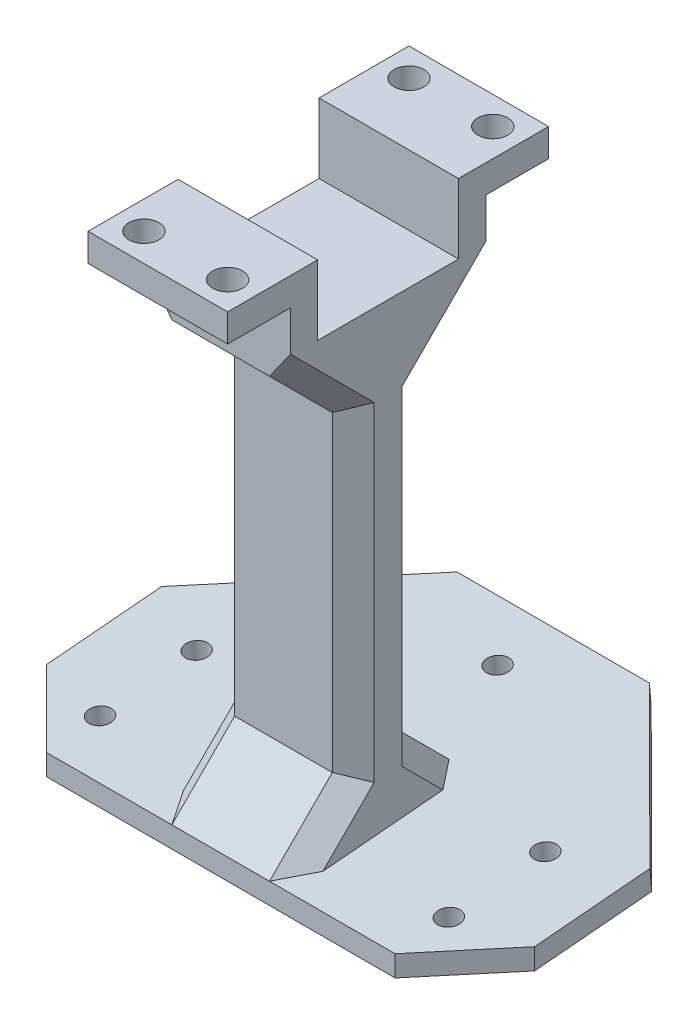
from build123d import *

# Parameters (mm, degrees)
SKETCH1_W           = 20
SKETCH1_H           = 53.344530479
BOSS_EXTRUDE1_DEPTH = 28
BOSS_EXTRUDE2_START = -426.399445517
BOSS_EXTRUDE2_DEPTH = 20
BOSS_EXTRUDE3_DEPTH = 20
SKETCH4_R           = 2.15
CUT_EXTRUDE1_DEPTH  = 10
SKETCH6_R           = 1.6
BOSS_EXTRUDE5_DEPTH = 3
SKETCH7_W           = 104.374043795
SKETCH7_H           = 16.644454458
CUT_EXTRUDE2_DEPTH  = 3
CHAMFER1_SIZE       = 10
CUT_EXTRUDE3_DEPTH  = 60
CHAMFER2_SIZE       = 3


# Read off the part's stored shape, not the designer's step: Boss-Extrude2
with BuildPart() as part:
    # Sketch1 → Boss-Extrude1 (new body)
    with BuildSketch(Plane.XY):
        with Locations((-416.399445517, 267.662547877)):
            Rectangle(SKETCH1_W, SKETCH1_H)
    extrude(amount=-BOSS_EXTRUDE1_DEPTH)

    # Boss-Extrude2 outline → Boss-Extrude2 (add)
    with BuildSketch(Plane.YZ.offset(BOSS_EXTRUDE2_START)):
        Polygon((227.085747643, -28), (240.990282637, -28), (240.990282637, 0), (224.636065064, 0), align=None)
    extrude(amount=BOSS_EXTRUDE2_DEPTH)

    # Sketch3 → Boss-Extrude3 (add)
    with BuildSketch(Plane.ZY.offset(426.399445517)):
        Polygon((-28, 300.334813116), (-37, 300.334813116), (-37, 304.334813116), (-24.1, 304.334813116), (-24.1, 294.334813116), (-28, 294.334813116), align=None)
        Polygon((9, 300.334813116), (9, 304.334813116), (-3.9, 304.334813116), (-3.9, 294.334813116), (0, 294.334813116), (0, 300.334813116), align=None)
    extrude(amount=-BOSS_EXTRUDE3_DEPTH)

    # Sketch4 → Cut-Extrude1 (cut)
    with BuildSketch(Plane(origin=(0, 304.334813116, 0), x_dir=(1, 0, 0), z_dir=(0, 1, 0))):
        with Locations(Location((-422.399445517, 33, 0), (0, 0, 270))):
            Circle(SKETCH4_R)
        with Locations(Location((-410.399445517, 33, 0), (0, 0, 270))):
            Circle(SKETCH4_R)
        with Locations(Location((-410.399445517, -5, 0), (0, 0, 90))):
            Circle(SKETCH4_R)
        with Locations(Location((-422.399445517, -5, 0), (0, 0, 90))):
            Circle(SKETCH4_R)
    extrude(amount=-CUT_EXTRUDE1_DEPTH, mode=Mode.SUBTRACT)

    # Sketch6 → Boss-Extrude5 (add)
    # profile 1 of 2: a face of its own
    with BuildSketch(Plane(origin=(0, 222.929701773, 19.503821668), x_dir=(1, 0, 0), z_dir=(0, -0.9961946980917453, -0.087155742747662))):
        with BuildLine():
            Line((-426.399445517, -19.578323099), (-451.399445517, -19.578323099))
            Line((-451.399445517, -19.578323099), (-451.399445517, -46.472075114))
            Line((-451.399445517, -46.472075114), (-430.186242082, -67.68527855))
            Line((-430.186242082, -67.68527855), (-416.399445517, -67.68527855))
            Line((-416.399445517, -67.68527855), (-416.399445517, -61.28527855))
            ThreePointArc((-416.399445517, -61.28527855), (-417.999445517, -59.68527855), (-416.399445517, -58.08527855))
            Line((-416.399445517, -58.08527855), (-416.399445517, -47.68527855))
            Line((-416.399445517, -47.68527855), (-426.399445517, -47.68527855))
            Line((-426.399445517, -47.68527855), (-426.399445517, -19.578323099))
        make_face()
        with Locations(Location((-441.399445517, -41.472075114, 0), (0, 0, 270))):
            Circle(SKETCH6_R, mode=Mode.SUBTRACT)
        with Locations(Location((-441.399445517, -27.578323099, 0), (0, 0, 270))):
            Circle(SKETCH6_R, mode=Mode.SUBTRACT)
    # profile 2 of 2: a face of its own
    with BuildSketch(Plane(origin=(0, 222.929701773, 19.503821668), x_dir=(1, 0, 0), z_dir=(0, -0.9961946980917453, -0.087155742747662))):
        with BuildLine():
            Line((-416.399445517, -61.28527855), (-416.399445517, -67.68527855))
            Line((-416.399445517, -67.68527855), (-402.612648953, -67.68527855))
            Line((-402.612648953, -67.68527855), (-381.399445517, -46.472075114))
            Line((-381.399445517, -46.472075114), (-381.399445517, -19.578323099))
            Line((-381.399445517, -19.578323099), (-406.399445517, -19.578323099))
            Line((-406.399445517, -19.578323099), (-406.399445517, -47.68527855))
            Line((-406.399445517, -47.68527855), (-416.399445517, -47.68527855))
            Line((-416.399445517, -47.68527855), (-416.399445517, -58.08527855))
            ThreePointArc((-416.399445517, -58.08527855), (-415.268074667, -58.5539077), (-414.799445517, -59.68527855))
            ThreePointArc((-414.799445517, -59.68527855), (-415.268074667, -60.8166494), (-416.399445517, -61.28527855))
        make_face()
        with Locations(Location((-391.399445517, -41.472075114, 0), (0, 0, 270))):
            Circle(SKETCH6_R, mode=Mode.SUBTRACT)
        with Locations(Location((-391.399445517, -27.578323099, 0), (0, 0, 270))):
            Circle(SKETCH6_R, mode=Mode.SUBTRACT)
    extrude(amount=-BOSS_EXTRUDE5_DEPTH)

    # Sketch7 → Cut-Extrude2 (cut)
    with BuildSketch(Plane.XY):
        with Locations((-415.627785026, 222.829224709)):
            Rectangle(SKETCH7_W, SKETCH7_H)
    extrude(amount=CUT_EXTRUDE2_DEPTH, mode=Mode.SUBTRACT)

    # Chamfer1
    chamfer1_edges = [part.edges().sort_by_distance(p)[0] for p in [
        (-451.399445517, 226.141794821, 0),
        (-381.399445517, 226.141794821, 0),
    ]]
    chamfer(chamfer1_edges, length=CHAMFER1_SIZE)

    # Sketch8 → Cut-Extrude3 (cut)
    with BuildSketch(Plane.ZY.offset(426.399445517)):
        Polygon((-28, 290.334813116), (-19, 281.334813116), (-19, 236.647524577), (-25.747394836, 229.90012974), (-28, 230.097207156), align=None)
        Polygon((0, 290.334813116), (-9, 281.334813116), (-9, 236.647524577), (0, 227.647524577), align=None)
    extrude(amount=-CUT_EXTRUDE3_DEPTH, mode=Mode.SUBTRACT)

    # Chamfer2
    chamfer2_edges = [part.edges().sort_by_distance(p)[0] for p in [
        (-406.399445517, 258.991168846, -9),
        (-406.399445517, 258.991168846, -19),
        (-406.399445517, 285.834813116, -23.5),
        (-406.399445517, 233.273827159, -22.373697418),
        (-426.399445517, 233.273827159, -22.373697418),
        (-426.399445517, 258.991168846, -19),
        (-426.399445517, 285.834813116, -23.5),
        (-406.399445517, 285.834813116, -4.5),
        (-406.399445517, 232.147524577, -4.5),
        (-426.399445517, 285.834813116, -4.5),
        (-426.399445517, 258.991168846, -9),
        (-426.399445517, 232.147524577, -4.5),
    ]]
    chamfer(chamfer2_edges, length=CHAMFER2_SIZE)


solid = part.part
